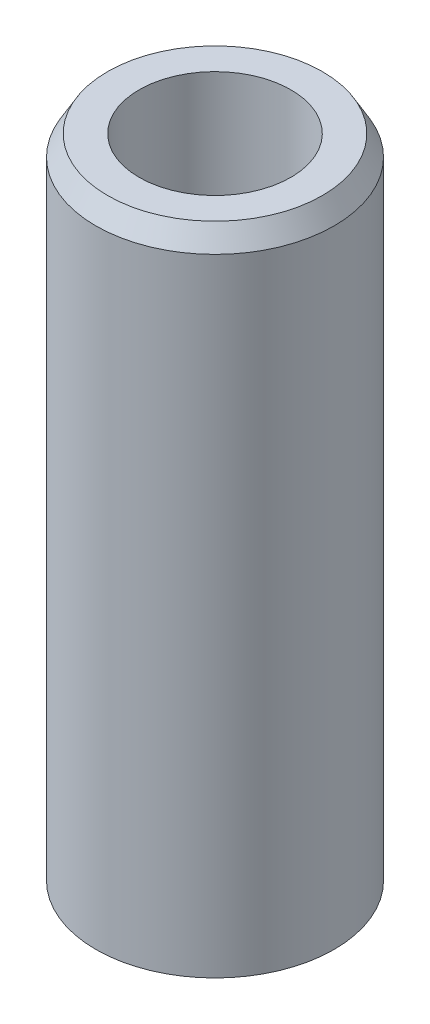
from build123d import *
from OCP.BRepFilletAPI import BRepFilletAPI_MakeChamfer

# Parameters (mm, degrees)
SKETCH1_R           = 17.5
BOSS_EXTRUDE1_DEPTH = 96.749567912
SKETCH2_R           = 11.146254931
CUT_EXTRUDE1_DEPTH  = 100.864803065
CHAMFER1_SIZE       = 2.994579027
CHAMFER1_SIZE2      = 1.728921008


with BuildPart() as part:
    # Sketch1 → Boss-Extrude1 (new body)
    with BuildSketch(Plane(origin=(0, 0, 0), x_dir=(1, 0, 0), z_dir=(0, 1, 0))):
        Circle(SKETCH1_R)
    extrude(amount=BOSS_EXTRUDE1_DEPTH)

    # Sketch2 → Cut-Extrude1 (cut, through all)
    with BuildSketch(Plane(origin=(0, 0, 0), x_dir=(1, 0, 0), z_dir=(0, 1, 0))):
        Circle(SKETCH2_R)
    extrude(amount=CUT_EXTRUDE1_DEPTH, mode=Mode.SUBTRACT)

    # Chamfer1: one chamfer whose edges measure the first distance from different faces: ONE call of the kernel's chamfer builder (chamfer() names one face for all edges)
    chamfer1_edges_1 = [part.edges().sort_by_distance(p)[0] for p in [
        (-17.5, 96.749567912, 0),
    ]]
    chamfer1_side_1 = [part.faces().sort_by_distance(p)[0] for p in [
        (-17.5, 48.374783956, 0),
    ]]
    chamfer1_edges_2 = [part.edges().sort_by_distance(p)[0] for p in [
        (-17.5, 0, 0),
    ]]
    chamfer1_side_2 = [part.faces().sort_by_distance(p)[0] for p in [
        (-17.005025253, 0, 0),
    ]]
    chamfer1 = BRepFilletAPI_MakeChamfer(part.part.solid().wrapped)
    for e in chamfer1_edges_1:
        chamfer1.Add(CHAMFER1_SIZE, CHAMFER1_SIZE2, e.wrapped, chamfer1_side_1[0].wrapped)  # the first distance lies on this face
    for e in chamfer1_edges_2:
        chamfer1.Add(CHAMFER1_SIZE, CHAMFER1_SIZE2, e.wrapped, chamfer1_side_2[0].wrapped)  # the first distance lies on this face
    add(Compound.cast(chamfer1.Shape()), mode=Mode.REPLACE)


solid = part.part
